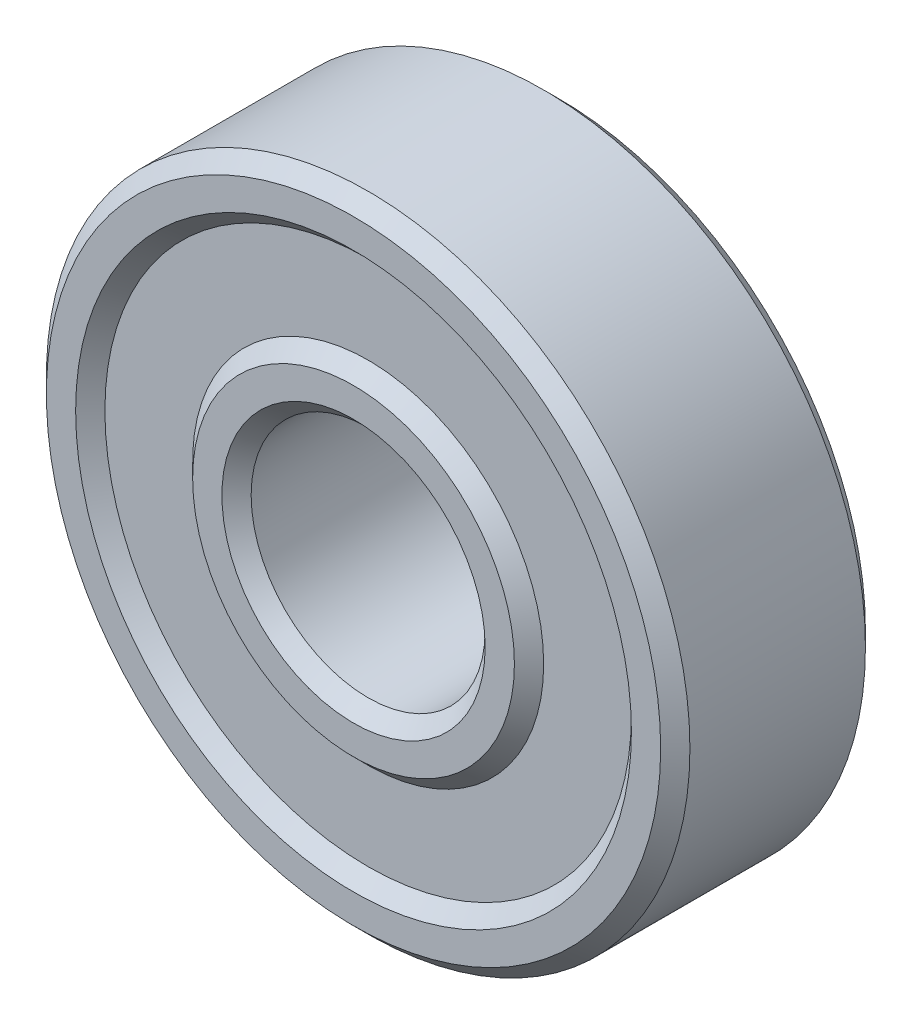
from build123d import *

# Parameters (mm, degrees)
SKETCH1_R           = 11
SKETCH1_R_2         = 4
BOSS_EXTRUDE1_DEPTH = 3.5
CUT_EXTRUDE1_START  = -3.5
SKETCH1_3_R         = 9
SKETCH1_3_R_2       = 6
CUT_EXTRUDE1_DEPTH  = 0.5
CUT_EXTRUDE2_START  = 3
SKETCH1_4_R         = 9
SKETCH1_4_R_2       = 6
CUT_EXTRUDE2_DEPTH  = 0.5
CHAMFER1_SIZE       = 0.5


with BuildPart() as part:
    # Sketch1 → Boss-Extrude1 (new, symmetric)
    with BuildSketch(Plane.XY):
        Circle(SKETCH1_R)
        Circle(SKETCH1_R_2, mode=Mode.SUBTRACT)
    extrude(amount=BOSS_EXTRUDE1_DEPTH, both=True)

    # Sketch1<3> → Cut-Extrude1 (cut)
    with BuildSketch(Plane.XY.offset(CUT_EXTRUDE1_START)):
        Circle(SKETCH1_3_R)
        Circle(SKETCH1_3_R_2, mode=Mode.SUBTRACT)
    extrude(amount=CUT_EXTRUDE1_DEPTH, mode=Mode.SUBTRACT)

    # Sketch1<4> → Cut-Extrude2 (cut)
    with BuildSketch(Plane.XY.offset(CUT_EXTRUDE2_START)):
        Circle(SKETCH1_4_R)
        Circle(SKETCH1_4_R_2, mode=Mode.SUBTRACT)
    extrude(amount=CUT_EXTRUDE2_DEPTH, mode=Mode.SUBTRACT)

    # Chamfer1
    chamfer1_edges = [part.edges().sort_by_distance(p)[0] for p in [
        (-6, 0, -3.5),
        (-9, 0, -3.5),
        (-11, 0, -3.5),
        (-9, 0, 3.5),
        (-6, 0, 3.5),
        (-11, 0, 3.5),
        (-4, 0, -3.5),
        (-4, 0, 3.5),
    ]]
    chamfer(chamfer1_edges, length=CHAMFER1_SIZE - 0.0001)  # a hair under: the kernel refuses the full size


solid = part.part
